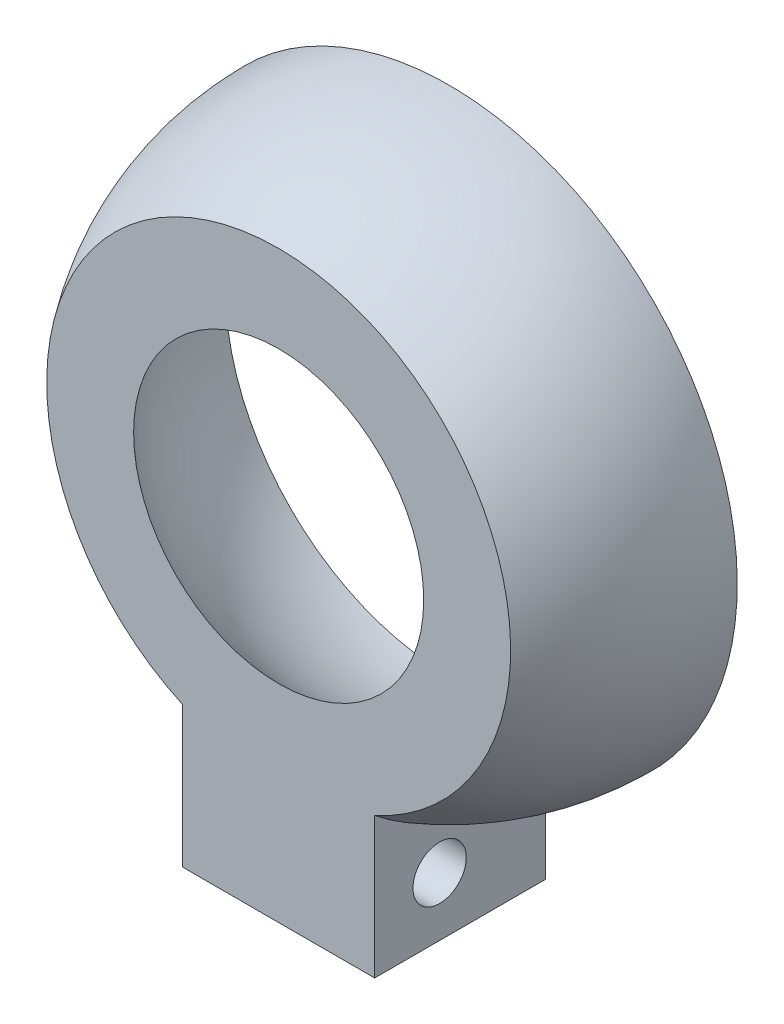
from build123d import *

# Parameters (mm, degrees)
SKETCH4_W                = 9
SKETCH4_H                = 8
BASEBOSS_DEPTH           = 3
BOSS_EXTRUDE3_REACH      = 37.383
BOSS_EXTRUDE3_END_RADIUS = 10.5
SKETCH4_5_W              = 9
SKETCH4_5_H              = 8
CUT_EXTRUDE2_REACH       = 94.415
SKETCH7_R                = 1.25


with BuildPart() as part:
    # Sketch4 → BaseBoss (new body)
    with BuildSketch(Plane(origin=(0, 60.25, 0), x_dir=(1, 0, 0), z_dir=(0, 1, 0))):
        with Locations((-3.25, 4.451253904)):
            Rectangle(SKETCH4_W, SKETCH4_H)
    extrude(amount=BASEBOSS_DEPTH)



with BuildPart() as body_2:
    # Sketch5 → CoverRevolve (revolve)
    with BuildSketch(Plane.ZY.offset(3.25)):
        with BuildLine():
            Line((-8.451253904, 63.25), (-8.451253904, 66.25))
            ThreePointArc((-8.451253904, 66.25), (-4.044311663, 67.219582376), (-0.451253904, 69.949264746))
            Line((-0.451253904, 69.949264746), (-0.451253904, 65.875718415))
            ThreePointArc((-0.451253904, 65.875718415), (-4.24131337, 63.923215496), (-8.451253904, 63.25))
        make_face()
    revolve(axis=Axis((-3.25, 76.75, -0.451253904), (0, 0, -1)))


with BuildPart() as part_1:
    add(part.part)

    add(body_2.part)  # Boss-Extrude3 merges body 2
    # Boss-Extrude3: up to this sphere (the profile starts outside it)
    boss_extrude3_end = Location((-3.25, 76.75, -8.451253904)) * Sphere(BOSS_EXTRUDE3_END_RADIUS, mode=Mode.PRIVATE)
    # Sketch4<5> → Boss-Extrude3 (add, up to the surface)
    with BuildSketch(Plane(origin=(0, 60.25, 0), x_dir=(1, 0, 0), z_dir=(0, 1, 0)), mode=Mode.PRIVATE) as boss_extrude3_sk1:
        with Locations((-3.25, 4.451253904)):
            Rectangle(SKETCH4_5_W, SKETCH4_5_H)
    boss_extrude3_tool1 = extrude(boss_extrude3_sk1.sketch, amount=BOSS_EXTRUDE3_REACH, mode=Mode.PRIVATE) - boss_extrude3_end
    add(boss_extrude3_tool1.solids().sort_by_distance((-3.25, 60.25, -4.451254))[0])

    # Sketch7 → Cut-Extrude2 (cut, up to next)
    with BuildSketch(Plane(origin=(1.25, 0, 0), x_dir=(0, 0, -1), z_dir=(1, 0, 0)), mode=Mode.PRIVATE) as cut_extrude2_sk1:
        with Locations((3.496708449, 63)):
            Circle(SKETCH7_R)
    cut_extrude2_tool1 = extrude(cut_extrude2_sk1.sketch, amount=-CUT_EXTRUDE2_REACH, mode=Mode.PRIVATE) & part_1.part
    add(cut_extrude2_tool1.solids().sort_by_distance((1.25, 63, -3.496708))[0], mode=Mode.SUBTRACT)


solid = part_1.part
